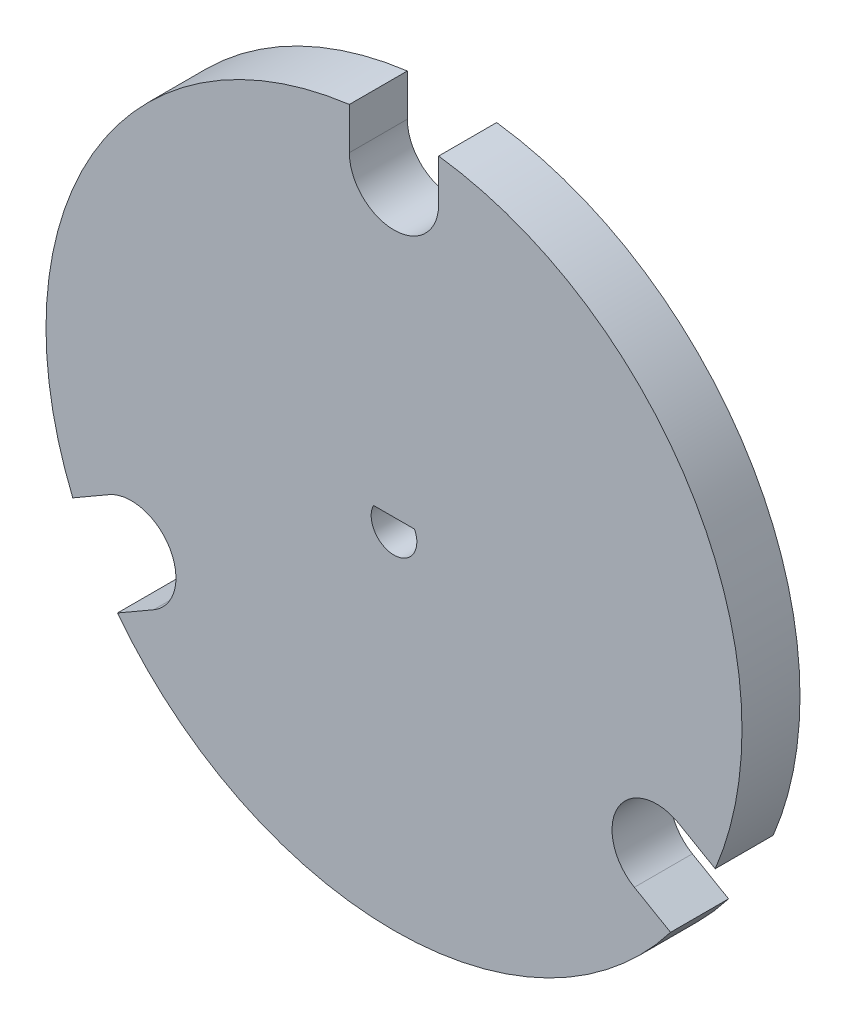
from build123d import *

# Parameters (mm, degrees)
SKETCH1_R           = 38.1
BOSS_EXTRUDE1_DEPTH = 6.35
CUT_EXTRUDE1_DEPTH  = 55.254423783
CUT_EXTRUDE2_DEPTH  = 55.254423783


with BuildPart() as part:
    # Sketch1 → Boss-Extrude1 (new body)
    with BuildSketch(Plane.XY):
        Circle(SKETCH1_R)
    extrude(amount=BOSS_EXTRUDE1_DEPTH)

    # Sketch2 → Cut-Extrude1 (cut, through all)
    with BuildSketch(Plane.XY.offset(6.35)):
        with BuildLine():
            Line((-4.8895, 33.2105), (-4.8895, 37.784954542))
            ThreePointArc((-4.8895, 37.784954542), (0, 38.1), (4.8895, 37.784954542))
            Line((4.8895, 37.784954542), (4.8895, 33.2105))
            ThreePointArc((4.8895, 33.2105), (0, 28.321), (-4.8895, 33.2105))
        make_face()
        with BuildLine():
            Line((31.205886672, -12.370818788), (35.167480514, -14.658046059))
            ThreePointArc((35.167480514, -14.658046059), (32.995567884, -19.05), (30.277980514, -23.126908483))
            Line((30.277980514, -23.126908483), (26.316386672, -20.839681212))
            ThreePointArc((26.316386672, -20.839681212), (24.526705461, -14.1605), (31.205886672, -12.370818788))
        make_face()
        with BuildLine():
            Line((-26.316386672, -20.839681212), (-30.277980514, -23.126908483))
            ThreePointArc((-30.277980514, -23.126908483), (-32.995567884, -19.05), (-35.167480514, -14.658046059))
            Line((-35.167480514, -14.658046059), (-31.205886672, -12.370818788))
            ThreePointArc((-31.205886672, -12.370818788), (-24.526705461, -14.1605), (-26.316386672, -20.839681212))
        make_face()
    extrude(amount=-CUT_EXTRUDE1_DEPTH, mode=Mode.SUBTRACT)

    # Sketch3 → Cut-Extrude2 (cut, through all)
    with BuildSketch(Plane.XY.offset(6.35)):
        with BuildLine():
            Line((-2.25, 1.089724736), (2.25, 1.089724736))
            ThreePointArc((2.25, 1.089724736), (0, -2.5), (-2.25, 1.089724736))
        make_face()
    extrude(amount=-CUT_EXTRUDE2_DEPTH, mode=Mode.SUBTRACT)


solid = part.part
